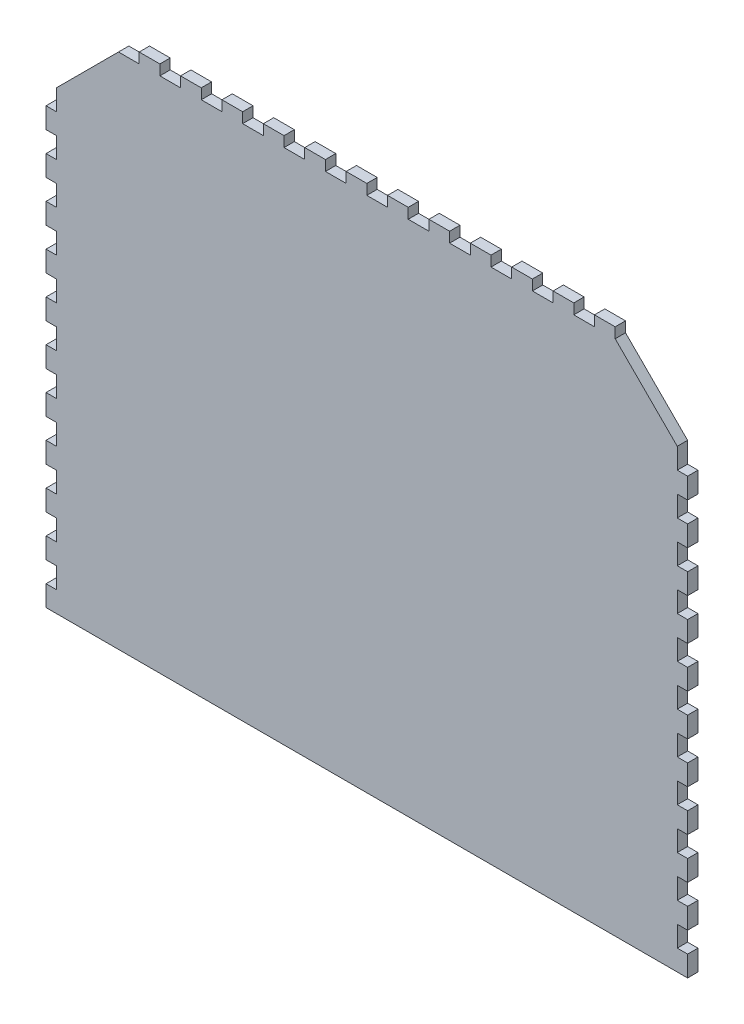
from build123d import *

# Parameters (mm, degrees)
AUFSATZ_LINEAR_AUSTRAGEN1_DEPTH = 5


with BuildPart() as part:
    # Skizze1 → Aufsatz-Linear austragen1 (new body)
    with BuildSketch(Plane.XY):
        Polygon((430.89618142, 326.340211581), (430.89618142, 336.340211581), (425.89618142, 336.340211581), (425.89618142, 346.340211581), (430.89618142, 346.340211581), (430.89618142, 356.340211581), (425.89618142, 356.340211581), (425.89618142, 366.340211581), (430.89618142, 366.340211581), (430.89618142, 376.340211581), (425.89618142, 376.340211581), (425.89618142, 386.340211581), (430.89618142, 386.340211581), (430.89618142, 396.340211581), (425.89618142, 396.340211581), (425.89618142, 406.340211581), (430.89618142, 406.340211581), (430.89618142, 416.340211581), (425.89618142, 416.340211581), (425.89618142, 426.340211581), (430.89618142, 426.340211581), (430.89618142, 436.340211581), (425.89618142, 436.340211581), (425.89618142, 446.340211581), (430.89618142, 446.340211581), (430.89618142, 456.340211581), (425.89618142, 456.340211581), (425.89618142, 466.340211581), (430.89618142, 466.340211581), (430.89618142, 476.340211581), (425.89618142, 476.340211581), (425.89618142, 486.340211581), (430.89618142, 486.340211581), (430.89618142, 496.340211581), (425.89618142, 496.340211581), (425.89618142, 506.340211581), (430.89618142, 506.340211581), (430.89618142, 516.340211581), (425.89618142, 516.340211581), (425.89618142, 526.340211581), (430.89618142, 526.340211581), (430.89618142, 536.340211581), (460.89618142, 566.340211581), (470.89618142, 566.340211581), (470.89618142, 571.340211581), (480.89618142, 571.340211581), (480.89618142, 566.340211581), (490.89618142, 566.340211581), (490.89618142, 571.340211581), (500.89618142, 571.340211581), (500.89618142, 566.340211581), (510.89618142, 566.340211581), (510.89618142, 571.340211581), (520.89618142, 571.340211581), (520.89618142, 566.340211581), (530.89618142, 566.340211581), (530.89618142, 571.340211581), (540.89618142, 571.340211581), (540.89618142, 566.340211581), (550.89618142, 566.340211581), (550.89618142, 571.340211581), (560.89618142, 571.340211581), (560.89618142, 566.340211581), (570.89618142, 566.340211581), (570.89618142, 571.340211581), (580.89618142, 571.340211581), (580.89618142, 566.340211581), (590.89618142, 566.340211581), (590.89618142, 571.340211581), (600.89618142, 571.340211581), (600.89618142, 566.340211581), (610.89618142, 566.340211581), (610.89618142, 571.340211581), (620.89618142, 571.340211581), (620.89618142, 566.340211581), (630.89618142, 566.340211581), (630.89618142, 571.340211581), (640.89618142, 571.340211581), (640.89618142, 566.340211581), (650.89618142, 566.340211581), (650.89618142, 571.340211581), (660.89618142, 571.340211581), (660.89618142, 566.340211581), (670.89618142, 566.340211581), (670.89618142, 571.340211581), (680.89618142, 571.340211581), (680.89618142, 566.340211581), (690.89618142, 566.340211581), (690.89618142, 571.340211581), (700.89618142, 571.340211581), (700.89618142, 566.340211581), (730.89618142, 536.340211581), (730.89618142, 526.340211581), (735.89618142, 526.340211581), (735.89618142, 516.340211581), (730.89618142, 516.340211581), (730.89618142, 506.340211581), (735.89618142, 506.340211581), (735.89618142, 496.340211581), (730.89618142, 496.340211581), (730.89618142, 486.340211581), (735.89618142, 486.340211581), (735.89618142, 476.340211581), (730.89618142, 476.340211581), (730.89618142, 466.340211581), (735.89618142, 466.340211581), (735.89618142, 456.340211581), (730.89618142, 456.340211581), (730.89618142, 446.340211581), (735.89618142, 446.340211581), (735.89618142, 436.340211581), (730.89618142, 436.340211581), (730.89618142, 426.340211581), (735.89618142, 426.340211581), (735.89618142, 416.340211581), (730.89618142, 416.340211581), (730.89618142, 406.340211581), (735.89618142, 406.340211581), (735.89618142, 396.340211581), (730.89618142, 396.340211581), (730.89618142, 386.340211581), (735.89618142, 386.340211581), (735.89618142, 376.340211581), (730.89618142, 376.340211581), (730.89618142, 366.340211581), (735.89618142, 366.340211581), (735.89618142, 356.340211581), (730.89618142, 356.340211581), (730.89618142, 346.340211581), (735.89618142, 346.340211581), (735.89618142, 336.340211581), (730.89618142, 336.340211581), (730.89618142, 326.340211581), (735.89618142, 326.340211581), (735.89618142, 316.340211581), (730.89618142, 316.340211581), (430.89618142, 316.340211581), (425.89618142, 316.340211581), (425.89618142, 326.340211581), align=None)
    extrude(amount=AUFSATZ_LINEAR_AUSTRAGEN1_DEPTH)


solid = part.part
